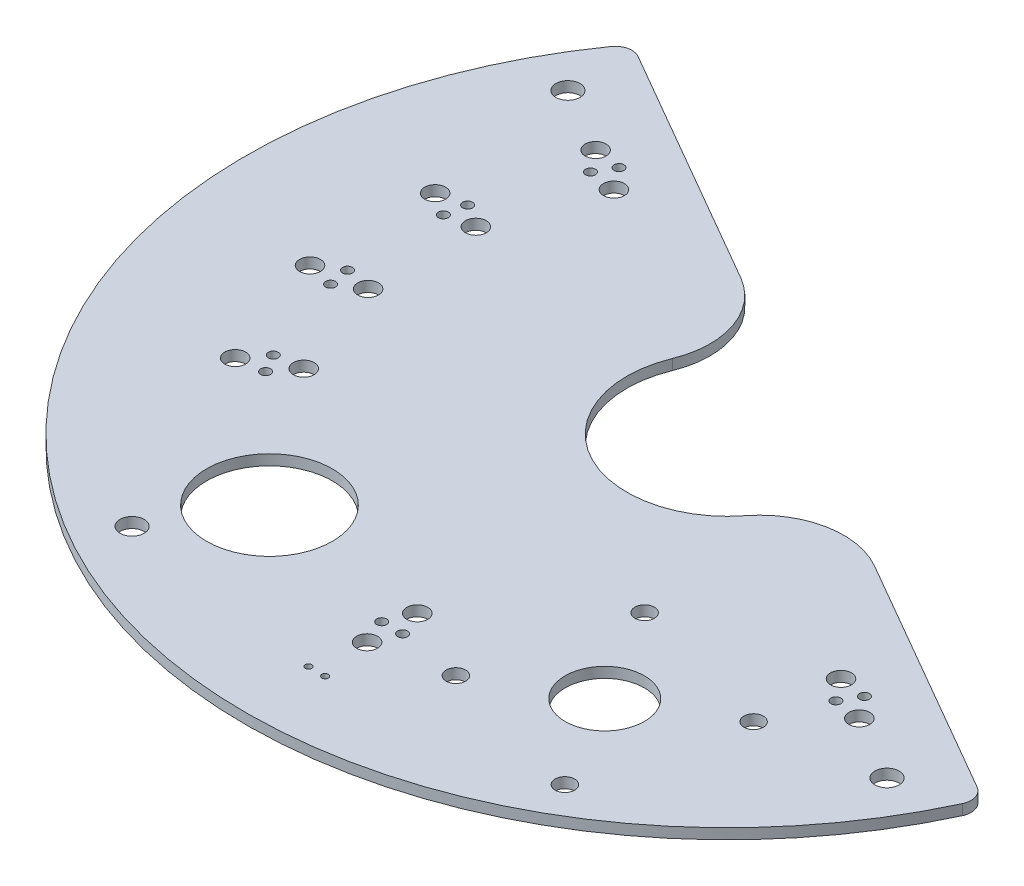
from build123d import *

# Parameters (mm, degrees)
SKETCH1_R           = 73.025
SKETCH1_R_2         = 15.24
SKETCH1_R_3         = 0.75
SKETCH1_R_4         = 1.585
SKETCH1_R_5         = 20
SKETCH1_R_6         = 9.525
SKETCH1_R_7         = 6
BOSS_EXTRUDE1_DEPTH = 1.5875
SKETCH2_R           = 1.8288
CUT_EXTRUDE1_DEPTH  = 104.285146107
CUT_EXTRUDE2_DEPTH  = 104.285146107
FILLET1_R           = 12.7
FILLET2_R           = 2.54
SKETCH4_R           = 0.4953
CUT_EXTRUDE3_DEPTH  = 104.285146107
SKETCH5_R           = 0.75
SKETCH5_R_2         = 0.4953
BOSS_EXTRUDE2_DEPTH = 0.1016
SKETCH6_R           = 1.4732
CUT_EXTRUDE4_DEPTH  = 104.285146107


with BuildPart() as part:
    # Sketch1 → Boss-Extrude1 (new body)
    with BuildSketch(Plane(origin=(0, 0, 0), x_dir=(1, 0, 0), z_dir=(0, 1, 0))):
        Circle(SKETCH1_R)
        Circle(SKETCH1_R_2, mode=Mode.SUBTRACT)
        with Locations((-1.585, 50.8)):
            Circle(SKETCH1_R_3, mode=Mode.SUBTRACT)
        with Locations((1.585, 50.8)):
            Circle(SKETCH1_R_3, mode=Mode.SUBTRACT)
        with Locations((0, 54.6)):
            Circle(SKETCH1_R_4, mode=Mode.SUBTRACT)
        with Locations((0, 47)):
            Circle(SKETCH1_R_4, mode=Mode.SUBTRACT)
        with Locations((47.284987047, 27.3)):
            Circle(SKETCH1_R_4, mode=Mode.SUBTRACT)
        with Locations((43.201590512, 26.772650265)):
            Circle(SKETCH1_R_3, mode=Mode.SUBTRACT)
        with Locations((44.786590512, 24.027349735)):
            Circle(SKETCH1_R_3, mode=Mode.SUBTRACT)
        with Locations((40.703193978, 23.5)):
            Circle(SKETCH1_R_4, mode=Mode.SUBTRACT)
        with Locations((47.284987047, -27.3)):
            Circle(SKETCH1_R_4, mode=Mode.SUBTRACT)
        with Locations((44.786590512, -24.027349735)):
            Circle(SKETCH1_R_3, mode=Mode.SUBTRACT)
        with Locations((43.201590512, -26.772650265)):
            Circle(SKETCH1_R_3, mode=Mode.SUBTRACT)
        with Locations((40.703193978, -23.5)):
            Circle(SKETCH1_R_4, mode=Mode.SUBTRACT)
        with Locations((0, -54.6)):
            Circle(SKETCH1_R_4, mode=Mode.SUBTRACT)
        with Locations((1.585, -50.8)):
            Circle(SKETCH1_R_3, mode=Mode.SUBTRACT)
        with Locations((-1.585, -50.8)):
            Circle(SKETCH1_R_3, mode=Mode.SUBTRACT)
        with Locations((0, -47)):
            Circle(SKETCH1_R_4, mode=Mode.SUBTRACT)
        with Locations((-47.284987047, -27.3)):
            Circle(SKETCH1_R_4, mode=Mode.SUBTRACT)
        with Locations((-43.201590512, -26.772650265)):
            Circle(SKETCH1_R_3, mode=Mode.SUBTRACT)
        with Locations((-44.786590512, -24.027349735)):
            Circle(SKETCH1_R_3, mode=Mode.SUBTRACT)
        with Locations((-40.703193978, -23.5)):
            Circle(SKETCH1_R_4, mode=Mode.SUBTRACT)
        with Locations((-47.284987047, 27.3)):
            Circle(SKETCH1_R_4, mode=Mode.SUBTRACT)
        with Locations((-44.786590512, 24.027349735)):
            Circle(SKETCH1_R_3, mode=Mode.SUBTRACT)
        with Locations((-43.201590512, 26.772650265)):
            Circle(SKETCH1_R_3, mode=Mode.SUBTRACT)
        with Locations((-40.703193978, 23.5)):
            Circle(SKETCH1_R_4, mode=Mode.SUBTRACT)
        with Locations((25.4, 43.994090512)):
            Circle(SKETCH1_R_5, mode=Mode.SUBTRACT)
        with Locations((-25.4, -43.994090512)):
            Circle(SKETCH1_R_6, mode=Mode.SUBTRACT)
        with Locations((25.4, -43.994090512)):
            Circle(SKETCH1_R_7, mode=Mode.SUBTRACT)
        with Locations((-46.285964392, 8.16146435)):
            Circle(SKETCH1_R_4, mode=Mode.SUBTRACT)
        with Locations((-50.303466215, 7.260407137)):
            Circle(SKETCH1_R_3, mode=Mode.SUBTRACT)
        with Locations((-49.753001491, 10.382247714)):
            Circle(SKETCH1_R_3, mode=Mode.SUBTRACT)
        with Locations((-53.770503314, 9.481190501)):
            Circle(SKETCH1_R_4, mode=Mode.SUBTRACT)
        with Locations((-46.285964392, -8.16146435)):
            Circle(SKETCH1_R_4, mode=Mode.SUBTRACT)
        with Locations((-49.753001491, -10.382247714)):
            Circle(SKETCH1_R_3, mode=Mode.SUBTRACT)
        with Locations((-50.303466215, -7.260407137)):
            Circle(SKETCH1_R_3, mode=Mode.SUBTRACT)
        with Locations((-53.770503314, -9.481190501)):
            Circle(SKETCH1_R_4, mode=Mode.SUBTRACT)
    extrude(amount=-BOSS_EXTRUDE1_DEPTH)

    # Sketch2 → Cut-Extrude1 (cut, through all)
    with BuildSketch(Plane(origin=(0, 0, 0), x_dir=(1, 0, 0), z_dir=(0, 1, 0))):
        with Locations((-57.192317666, 33.02)):
            Circle(SKETCH2_R)
        with Locations((33.02, 57.192317666)):
            Circle(SKETCH2_R)
        with Locations((57.192317666, -33.02)):
            Circle(SKETCH2_R)
        with Locations((-33.02, -57.192317666)):
            Circle(SKETCH2_R)
    extrude(amount=-CUT_EXTRUDE1_DEPTH, mode=Mode.SUBTRACT)

    # Sketch3 → Cut-Extrude2 (cut, through all)
    with BuildSketch(Plane(origin=(0, 0, 0), x_dir=(1, 0, 0), z_dir=(0, 1, 0))):
        with BuildLine():
            Line((-59.533825484, 44.637157955), (68.423825484, -29.239226276))
            ThreePointArc((68.423825484, -29.239226276), (37.204677955, 64.440392498), (-59.533825484, 44.637157955))
        make_face()
    extrude(amount=-CUT_EXTRUDE2_DEPTH, mode=Mode.SUBTRACT)

    # Fillet1
    fillet1_edges = [part.edges().sort_by_distance(p)[0] for p in [
        (15.165033815, -0.79375, -1.509751431),
        (-6.275033815, -0.79375, -13.888180249),
    ]]
    fillet(fillet1_edges, radius=FILLET1_R)

    # Fillet2
    fillet2_edges = [part.edges().sort_by_distance(p)[0] for p in [
        (67.216123088, -0.79375, 28.541958973),
        (-58.326123088, -0.79375, -43.939890652),
    ]]
    fillet(fillet2_edges, radius=FILLET2_R)

    # Sketch4 → Cut-Extrude3 (cut, through all)
    with BuildSketch(Plane(origin=(0, 0, 0), x_dir=(1, 0, 0), z_dir=(0, 1, 0))):
        with Locations((1.27, -62.23)):
            Circle(SKETCH4_R)
        with Locations((-1.27, -62.23)):
            Circle(SKETCH4_R)
    extrude(amount=-CUT_EXTRUDE3_DEPTH, mode=Mode.SUBTRACT)

    # Sketch5 → Boss-Extrude2 (add)
    # profile 1 of 6: a face of its own
    with BuildSketch(Plane.XZ.offset(1.5875)):
        with BuildLine():
            Line((30.413547782, 24.598324481), (41.535902061, 31.019818718))
            ThreePointArc((41.535902061, 31.019818718), (42.622921377, 29.508420604), (43.654971217, 27.958966385))
            ThreePointArc((43.654971217, 27.958966385), (43.878655246, 25.698181398), (41.935772719, 26.875632368))
            ThreePointArc((41.935772719, 26.875632368), (41.454257835, 27.61255432), (40.959794735, 28.340851504))
            Line((40.959794735, 28.340851504), (29.89025274, 21.949848454))
            ThreePointArc((29.89025274, 21.949848454), (18.542, 32.115686074), (4.064, 36.860642425))
            Line((4.064, 36.860642425), (4.064, 49.642648525))
            ThreePointArc((4.064, 49.642648525), (3.186044586, 49.706717539), (2.307094012, 49.755260685))
            ThreePointArc((2.307094012, 49.755260685), (0.315950299, 50.849120827), (2.385689544, 51.785797268))
            ThreePointArc((2.385689544, 51.785797268), (4.24358118, 51.666742998), (6.096, 51.481055713))
            Line((6.096, 51.481055713), (6.096, 38.638067239))
            ThreePointArc((6.096, 38.638067239), (19.558, 33.875449694), (30.413547782, 24.598324481))
        make_face()
        with Locations((1.585, 50.8)):
            Circle(SKETCH5_R, mode=Mode.SUBTRACT)
        with Locations((43.201590512, 26.772650265)):
            Circle(SKETCH5_R, mode=Mode.SUBTRACT)
    # profile 2 of 6: a face of its own
    with BuildSketch(Plane.XZ.offset(1.5875)):
        with BuildLine():
            Line((28.012465947, 9.133950273), (57.576899656, 26.202984034))
            ThreePointArc((57.576899656, 26.202984034), (34.776311002, 52.842255245), (1.290730377, 63.245788488))
            ThreePointArc((1.290730377, 63.245788488), (0.254211512, 62.250730377), (1.249269623, 61.214211512))
            ThreePointArc((1.249269623, 61.214211512), (32.885954673, 51.645467864), (54.939165888, 27.026439226))
            Line((54.939165888, 27.026439226), (46.78921353, 22.321062039))
            ThreePointArc((46.78921353, 22.321062039), (46.421042914, 23.07698178), (46.040660761, 23.826830883))
            ThreePointArc((46.040660761, 23.826830883), (44.194605545, 25.150939428), (44.242866733, 22.879628318))
            ThreePointArc((44.242866733, 22.879628318), (44.640302422, 22.09416322), (45.023794735, 21.301797022))
            Line((45.023794735, 21.301797022), (29.080316768, 12.096825726))
            ThreePointArc((29.080316768, 12.096825726), (-15.748, 27.276336118), (-25.016316768, -19.135880208))
            Line((-25.016316768, -19.135880208), (-40.959794735, -28.340851504))
            ThreePointArc((-40.959794735, -28.340851504), (-41.454257835, -27.61255432), (-41.935772719, -26.875632369))
            ThreePointArc((-41.935772719, -26.875632369), (-43.878655246, -25.698181398), (-43.654971217, -27.958966385))
            ThreePointArc((-43.654971217, -27.958966385), (-42.622921377, -29.508420604), (-41.535902061, -31.019818718))
            Line((-41.535902061, -31.019818718), (-21.916465947, -19.692531996))
            ThreePointArc((-21.916465947, -19.692531996), (-14.732, 25.516572497), (28.012465947, 9.133950273))
        make_face()
        with Locations((1.27, 62.23)):
            Circle(SKETCH5_R_2, mode=Mode.SUBTRACT)
        with Locations((44.786590512, 24.027349735)):
            Circle(SKETCH5_R, mode=Mode.SUBTRACT)
        with Locations((-43.201590512, -26.772650265)):
            Circle(SKETCH5_R, mode=Mode.SUBTRACT)
    # profile 3 of 6: a face of its own
    with BuildSketch(Plane.XZ.offset(1.5875)):
        with BuildLine():
            Line((-6.096, 38.638067239), (-6.096, 51.481055713))
            ThreePointArc((-6.096, 51.481055713), (-4.24358118, 51.666742998), (-2.385689544, 51.785797268))
            ThreePointArc((-2.385689544, 51.785797268), (-0.315950299, 50.849120827), (-2.307094012, 49.755260685))
            ThreePointArc((-2.307094012, 49.755260685), (-3.186044586, 49.706717539), (-4.064, 49.642648525))
            Line((-4.064, 49.642648525), (-4.064, 36.860642425))
            ThreePointArc((-4.064, 36.860642425), (-18.542, 32.115686074), (-29.89025274, 21.949848454))
            Line((-29.89025274, 21.949848454), (-40.959794734, 28.340851504))
            ThreePointArc((-40.959794734, 28.340851504), (-41.454257834, 27.612554318), (-41.935772719, 26.875632366))
            ThreePointArc((-41.935772719, 26.875632366), (-43.878655247, 25.698181399), (-43.654971217, 27.958966385))
            ThreePointArc((-43.654971217, 27.958966385), (-42.622921377, 29.508420604), (-41.535902061, 31.019818718))
            Line((-41.535902061, 31.019818718), (-30.413547782, 24.598324481))
            ThreePointArc((-30.413547782, 24.598324481), (-19.558, 33.875449694), (-6.096, 38.638067239))
        make_face()
        with Locations((-1.585, 50.8)):
            Circle(SKETCH5_R, mode=Mode.SUBTRACT)
        with Locations((-43.201590512, 26.772650265)):
            Circle(SKETCH5_R, mode=Mode.SUBTRACT)
    # profile 4 of 6: a face of its own
    with BuildSketch(Plane.XZ.offset(1.5875)):
        with BuildLine():
            Line((-46.78921353, 22.321062039), (-54.939165888, 27.026439226))
            ThreePointArc((-54.939165888, 27.026439226), (-32.885954673, 51.645467864), (-1.249269623, 61.214211512))
            ThreePointArc((-1.249269623, 61.214211512), (-0.254211512, 62.250730377), (-1.290730377, 63.245788488))
            ThreePointArc((-1.290730377, 63.245788488), (-34.776311002, 52.842255245), (-57.576899656, 26.202984034))
            Line((-57.576899656, 26.202984034), (-47.631902061, 20.461236995))
            ThreePointArc((-47.631902061, 20.461236995), (-49.319566928, 15.969991589), (-50.584784004, 11.341954884))
            ThreePointArc((-50.584784004, 11.341954884), (-50.021744231, 9.141007472), (-48.598743805, 10.911954418))
            ThreePointArc((-48.598743805, 10.911954418), (-46.804887206, 17.035585761), (-44.242866731, 22.879628319))
            ThreePointArc((-44.242866731, 22.879628319), (-44.194605546, 25.150939429), (-46.040660762, 23.826830883))
            ThreePointArc((-46.040660762, 23.826830883), (-46.421042914, 23.07698178), (-46.78921353, 22.321062039))
        make_face()
        with Locations((-1.27, 62.23)):
            Circle(SKETCH5_R_2, mode=Mode.SUBTRACT)
        with Locations((-44.786590512, 24.027349735)):
            Circle(SKETCH5_R, mode=Mode.SUBTRACT)
        with Locations((-49.753001492, 10.382247714)):
            Circle(SKETCH5_R, mode=Mode.SUBTRACT)
    # profile 5 of 6: a face of its own
    with BuildSketch(Plane.XZ.offset(1.5875)):
        with BuildLine():
            ThreePointArc((-48.598743805, -10.911954419), (-50.02174423, -9.141007471), (-50.584784004, -11.341954884))
            ThreePointArc((-50.584784004, -11.341954884), (-48.714342613, -17.730570693), (-46.040660762, -23.826830883))
            ThreePointArc((-46.040660762, -23.826830883), (-44.194605545, -25.150939428), (-44.242866733, -22.879628318))
            ThreePointArc((-44.242866733, -22.879628318), (-46.804887207, -17.035585761), (-48.598743805, -10.911954419))
        make_face()
        with Locations((-49.753001492, -10.382247714)):
            Circle(SKETCH5_R, mode=Mode.SUBTRACT)
        with Locations((-44.786590512, -24.027349735)):
            Circle(SKETCH5_R, mode=Mode.SUBTRACT)
    # profile 6 of 6: a face of its own
    with BuildSketch(Plane.XZ.offset(1.5875)):
        with BuildLine():
            ThreePointArc((-51.413325287, -6.643063765), (-50.131472618, -8.518706864), (-49.399989148, -6.367866276))
            ThreePointArc((-49.399989148, -6.367866276), (-49.808720609, 0), (-49.399989147, 6.367866276))
            ThreePointArc((-49.399989147, 6.367866276), (-50.131472618, 8.518706864), (-51.413325287, 6.643063765))
            ThreePointArc((-51.413325287, 6.643063765), (-51.840720609, 0), (-51.413325287, -6.643063765))
        make_face()
        with Locations((-50.303466215, 7.260407137)):
            Circle(SKETCH5_R, mode=Mode.SUBTRACT)
        with Locations((-50.303466215, -7.260407137)):
            Circle(SKETCH5_R, mode=Mode.SUBTRACT)
    extrude(amount=BOSS_EXTRUDE2_DEPTH)

    # Sketch6 → Cut-Extrude4 (cut, through all)
    with BuildSketch(Plane.XZ.offset(1.5875)):
        with Locations((33.655, 58.292169929)):
            Circle(SKETCH6_R)
        with Locations((11.101920584, 52.249090512)):
            Circle(SKETCH6_R)
        with Locations((17.145, 29.696011096)):
            Circle(SKETCH6_R)
        with Locations((39.698079417, 35.739090512)):
            Circle(SKETCH6_R)
    extrude(amount=-CUT_EXTRUDE4_DEPTH, mode=Mode.SUBTRACT)


solid = part.part
